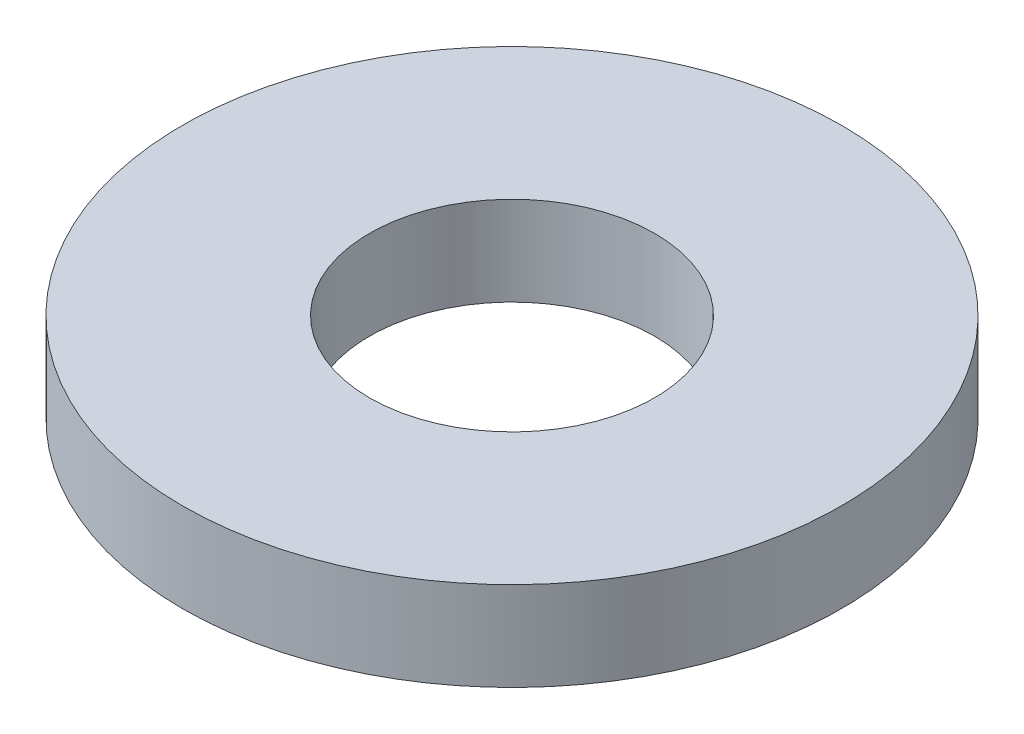
from build123d import *

# Parameters (mm, degrees)
SKETCH1_R           = 92.5
BOSS_EXTRUDE1_DEPTH = 25
SKETCH2_R           = 40
CUT_EXTRUDE1_DEPTH  = 134.182206019


with BuildPart() as part:
    # Sketch1 → Boss-Extrude1 (new body)
    with BuildSketch(Plane(origin=(0, 0, 0), x_dir=(1, 0, 0), z_dir=(0, 1, 0))):
        Circle(SKETCH1_R)
    extrude(amount=BOSS_EXTRUDE1_DEPTH)

    # Sketch2 → Cut-Extrude1 (cut, through all)
    with BuildSketch(Plane(origin=(0, 0, 0), x_dir=(1, 0, 0), z_dir=(0, 1, 0))):
        Circle(SKETCH2_R)
    extrude(amount=CUT_EXTRUDE1_DEPTH, mode=Mode.SUBTRACT)


solid = part.part
